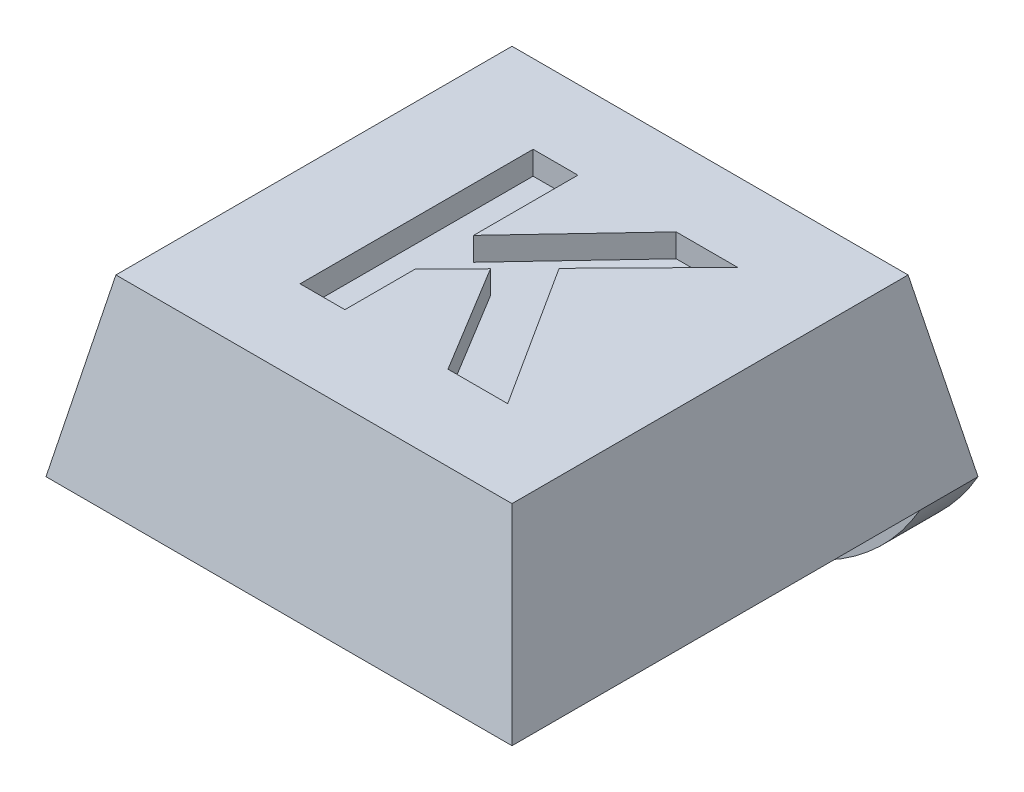
from build123d import *

# Parameters (mm, degrees)
SKETCH1_W               = 8
SKETCH1_H               = 8
BOSS_EXTRUDE1_DEPTH     = 3
CUT_EXTRUDE1_DEPTH      = 12.704699911
CUT_EXTRUDE1_DEPTH_BACK = 12.704699911
CUT_EXTRUDE2_DEPTH      = 11
SKETCH4_R               = 1.8
CUT_EXTRUDE3_DEPTH      = 0.8
SKETCH5_W               = 8
SKETCH5_H               = 1
BOSS_EXTRUDE2_DEPTH     = 2
FILLET1_R               = 4
CUT_EXTRUDE4_DEPTH      = 0.4


with BuildPart() as part:
    # Sketch1 → Boss-Extrude1 (new body)
    with BuildSketch(Plane(origin=(0, 0, 0), x_dir=(1, 0, 0), z_dir=(0, 1, 0))):
        with Locations((4, 4)):
            Rectangle(SKETCH1_W, SKETCH1_H)
    extrude(amount=BOSS_EXTRUDE1_DEPTH)

    # Sketch2 → Cut-Extrude1 (cut, two sides: drawn at the far end of the back side and taken through both)
    with BuildSketch(Plane.XY.offset(-CUT_EXTRUDE1_DEPTH_BACK)):
        Polygon((0, 0), (0.6, 3), (0, 3), align=None)
        Polygon((8, 0), (7.4, 3), (8, 3), align=None)
    extrude(amount=CUT_EXTRUDE1_DEPTH + CUT_EXTRUDE1_DEPTH_BACK, mode=Mode.SUBTRACT)

    # Sketch3 → Cut-Extrude2 (cut)
    with BuildSketch(Plane(origin=(0, 0, 0), x_dir=(0, 0, -1), z_dir=(1, 0, 0))):
        Polygon((0, 0), (0.6, 3), (0, 3), align=None)
        Polygon((8, 3), (7.4, 3), (8, 0), align=None)
    extrude(amount=CUT_EXTRUDE2_DEPTH, mode=Mode.SUBTRACT)

    # Sketch4 → Cut-Extrude3 (cut)
    with BuildSketch(Plane.XZ):
        with Locations(Location((4, -3.75, 0), (0, 0, 270))):
            Circle(SKETCH4_R)
    extrude(amount=-CUT_EXTRUDE3_DEPTH, mode=Mode.SUBTRACT)

    # Sketch5 → Boss-Extrude2 (add)
    with BuildSketch(Plane.XZ):
        with Locations((4, -7.5)):
            Rectangle(SKETCH5_W, SKETCH5_H)
    extrude(amount=BOSS_EXTRUDE2_DEPTH)

    # Fillet1
    # the kernel refuses this fillet: 4 mm, written as the material it takes off along each edge
    with BuildSketch(Plane(origin=(8, -2, -16.660254038), x_dir=(0, 1, 0), z_dir=(0, 0, 1)), Plane(origin=(0, -2, 1.660254038), x_dir=(0, 1, 0), z_dir=(0, 0, -1))) as fillet1_piece_1:
        with BuildLine():
            CenterArc((4, 3.464101615), FILLET1_R, 180, 60)
            Line((0, 3.464101615), (-0.08, 3.464101615))
            Line((-0.08, 3.464101615), (-0.08, 0))
            Line((-0.08, 0), (0, -0.08))
            ThreePointArc((0, -0.08), (1, -0.08), (1.96, -0.069282032))
            Line((1.96, -0.069282032), (2, 0))
        make_face()
    extrude(amount=18.320508076, mode=Mode.SUBTRACT)

    # Sketch6 → Cut-Extrude4 (cut)
    with BuildSketch(Plane(origin=(0, 3, 0), x_dir=(1, 0, 0), z_dir=(0, 1, 0))):
        Polygon((2.312898911, 2.049121591), (2.312898911, 6.049121591), (3.08212968, 6.049121591), (3.08212968, 4.258256206), (4.768828398, 6.049121591), (5.825719424, 6.049121591), (4.306488654, 4.502647232), (5.877001475, 2.049121591), (4.852161731, 2.049121591), (3.723155321, 3.907294667), (3.08212968, 3.255051078), (3.08212968, 2.049121591), align=None)
    extrude(amount=-CUT_EXTRUDE4_DEPTH, mode=Mode.SUBTRACT)


solid = part.part
